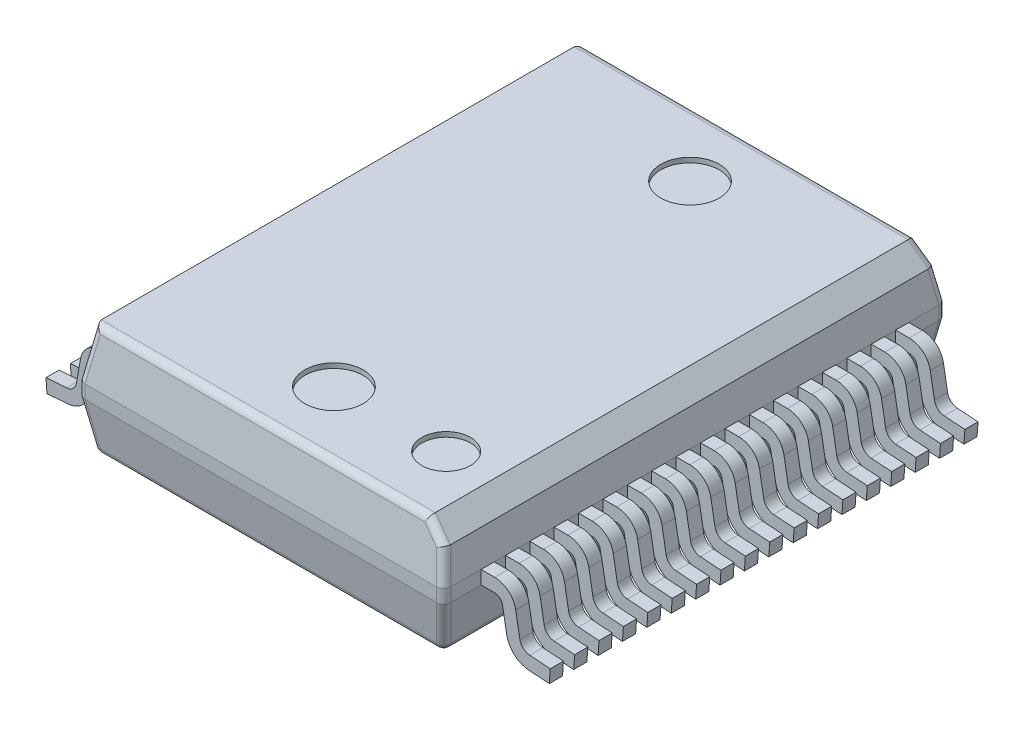
from build123d import *

# Parameters (mm, degrees)
SKETCH1_W               = 7.5
SKETCH1_H               = 10.3
BOSS_EXTRUDE1_DEPTH     = 2.28
CUT_EXTRUDE1_DEPTH      = 7.783354627
CUT_EXTRUDE1_DEPTH_BACK = 7.783354627
CUT_EXTRUDE2_DEPTH      = 7.783354627
CUT_EXTRUDE2_DEPTH_BACK = 7.783354627
SKETCH6_R               = 0.6
SKETCH6_R_2             = 0.5
CUT_EXTRUDE3_DEPTH      = 0.1
CHAMFER1_SIZE           = 0.3
CHAMFER1_SIZE2          = 0.369840916
SKETCH8_R               = 0.4
CUT_EXTRUDE4_DEPTH      = 0.1
FILLET1_R               = 0.15
BOSS_EXTRUDE2_DEPTH     = 0.05
BOSS_EXTRUDE2_2_DEPTH   = 0.05
BOSS_EXTRUDE2_3_DEPTH   = 0.05
SKETCH10_W              = 0.27
SKETCH10_H              = 0.275
LPATTERN1_COUNT         = 18
LPATTERN1_PITCH         = 0.5


with BuildPart() as part:
    # Sketch1 → Boss-Extrude1 (new body)
    with BuildSketch(Plane(origin=(0, 0.05, 0), x_dir=(-1, 0, 0), z_dir=(0, -1, 0))):
        Rectangle(SKETCH1_W, SKETCH1_H)
    extrude(amount=-BOSS_EXTRUDE1_DEPTH)

    # Sketch2 → Cut-Extrude1 (cut, two sides: drawn at the far end of the back side and taken through both)
    with BuildSketch(Plane(origin=(0, 0, 0), x_dir=(0, 0, -1), z_dir=(1, 0, 0)).offset(-CUT_EXTRUDE1_DEPTH_BACK)):
        Polygon((-5.15, 1.0525), (-4.973232202, 0.05), (-5.15, 0.05), align=None)
        Polygon((4.973232202, 0.05), (5.15, 0.05), (5.15, 1.0525), align=None)
        Polygon((-4.973232202, 2.33), (-5.15, 2.33), (-5.15, 1.3275), align=None)
        Polygon((4.973232202, 2.33), (5.15, 2.33), (5.15, 1.3275), align=None)
    extrude(amount=CUT_EXTRUDE1_DEPTH + CUT_EXTRUDE1_DEPTH_BACK, mode=Mode.SUBTRACT)

    # Sketch3 → Cut-Extrude2 (cut, two sides: drawn at the far end of the back side and taken through both)
    with BuildSketch(Plane.XY.offset(-CUT_EXTRUDE2_DEPTH_BACK)):
        Polygon((-3.75, 1.0525), (-3.573232202, 0.05), (-3.75, 0.05), align=None)
        Polygon((-3.573232202, 2.33), (-3.75, 2.33), (-3.75, 1.3275), align=None)
        Polygon((3.573232202, 0.05), (3.75, 0.05), (3.75, 1.0525), align=None)
        Polygon((3.573232202, 2.33), (3.75, 2.33), (3.75, 1.3275), align=None)
    extrude(amount=CUT_EXTRUDE2_DEPTH + CUT_EXTRUDE2_DEPTH_BACK, mode=Mode.SUBTRACT)

    # Sketch6 → Cut-Extrude3 (cut)
    with BuildSketch(Plane(origin=(0, 2.33, 0), x_dir=(1, 0, 0), z_dir=(0, 1, 0))):
        with Locations(Location((0, -3.65, 0), (0, 0, 270))):
            Circle(SKETCH6_R)
        with Locations(Location((2.3, -3.65, 0), (0, 0, 270))):
            Circle(SKETCH6_R_2)
        with Locations(Location((0, 3.65, 0), (0, 0, 90))):
            Circle(SKETCH6_R)
    extrude(amount=-CUT_EXTRUDE3_DEPTH, mode=Mode.SUBTRACT)

    # Chamfer1
    chamfer1_edges = [part.edges().sort_by_distance(p)[0] for p in [
        (3.573232202, 2.33, 0),
    ]]
    chamfer1_side = [part.faces().sort_by_distance(p)[0] for p in [
        (-0.026551385, 2.33, -0.042135894),
    ]]
    chamfer(chamfer1_edges, length=CHAMFER1_SIZE, length2=CHAMFER1_SIZE2, reference=chamfer1_side[0])

    # Sketch8 → Cut-Extrude4 (cut)
    with BuildSketch(Plane.XZ.offset(-0.05)):
        with Locations(Location((2.9, 4.3, 0), (0, 0, 270))):
            Circle(SKETCH8_R)
        with Locations(Location((0, 4.3, 0), (0, 0, 270))):
            Circle(SKETCH8_R)
        with Locations(Location((0, -4.3, 0), (0, 0, 90))):
            Circle(SKETCH8_R)
    extrude(amount=-CUT_EXTRUDE4_DEPTH, mode=Mode.SUBTRACT)

    # Fillet1
    # the kernel refuses this fillet: 0.15 mm, written as the material it takes off along each edge
    with BuildSketch(Plane(origin=(3.447367257, 0.2, -4.847367257), x_dir=(-0.112619742461807, -0.6386982979536941, 0.7611709911701118), z_dir=(0.5082206017326026, -0.6952867321825593, -0.5082206017326034))) as fillet1_piece_1_section:
        Polygon((-0.279329402, -0.279329402), (0.279329402, -0.279329402), (0.279329402, 0.279329402), (-0.279329402, 0.279329402), align=None)
    fillet1_piece_1 = extrude(amount=0.279329402, mode=Mode.PRIVATE)
    fillet1_piece_1 = split(fillet1_piece_1, bisect_by=Plane(origin=(3.447367257, 0.2, -4.847367257), z_dir=(0, 0, -1)), keep=Keep.TOP, mode=Mode.PRIVATE)
    fillet1_piece_1 = split(fillet1_piece_1, bisect_by=Plane(origin=(3.447367257, 0.2, -4.847367257), z_dir=(1, 0, 0)), keep=Keep.TOP, mode=Mode.PRIVATE)
    fillet1_piece_1 = split(fillet1_piece_1, bisect_by=Plane(origin=(3.447367257, 0.2, -4.847367257), z_dir=(-0.17108786974603082, -0.970287525247817, 0.17108786974602264)), keep=Keep.TOP, mode=Mode.PRIVATE)
    fillet1_piece_1 = split(fillet1_piece_1, bisect_by=Plane(origin=(3.59508842, 0.173952773, -4.847367257), z_dir=(-0.984807753012209, 0.1736481776669252, 0)), keep=Keep.TOP, mode=Mode.PRIVATE)
    fillet1_piece_1 = split(fillet1_piece_1, bisect_by=Plane(origin=(3.447367257, 0.05, -4.847367257), z_dir=(0, 1, 0)), keep=Keep.TOP, mode=Mode.PRIVATE)
    fillet1_piece_1 = split(fillet1_piece_1, bisect_by=Plane(origin=(3.447367257, 0.173952773, -4.99508842), z_dir=(0, 0.17364817766691715, 0.9848077530122105)), keep=Keep.TOP, mode=Mode.PRIVATE)
    fillet1_piece_1 = fillet1_piece_1 - Plane(origin=(3.447367257, 0.2, -4.847367257), x_dir=(-0.5082206017326026, 0.6952867321825593, 0.5082206017326034), z_dir=(-0.112619742461807, -0.6386982979536941, 0.7611709911701118)) * Sphere(FILLET1_R, mode=Mode.PRIVATE)
    add(fillet1_piece_1, mode=Mode.SUBTRACT)
    with BuildSketch(Plane(origin=(-3.447367257, 0.2, -4.847367257), x_dir=(-0.112619742461807, 0.6386982979536941, -0.7611709911701118), z_dir=(-0.5082206017326026, -0.6952867321825593, -0.5082206017326034))) as fillet1_piece_2_section:
        Polygon((-0.279329402, -0.279329402), (0.279329402, -0.279329402), (0.279329402, 0.279329402), (-0.279329402, 0.279329402), align=None)
    fillet1_piece_2 = extrude(amount=0.279329402, mode=Mode.PRIVATE)
    fillet1_piece_2 = split(fillet1_piece_2, bisect_by=Plane(origin=(-3.447367257, 0.2, -4.847367257), z_dir=(0, 0, -1)), keep=Keep.TOP, mode=Mode.PRIVATE)
    fillet1_piece_2 = split(fillet1_piece_2, bisect_by=Plane(origin=(-3.447367257, 0.2, -4.847367257), z_dir=(-1, 0, 0)), keep=Keep.TOP, mode=Mode.PRIVATE)
    fillet1_piece_2 = split(fillet1_piece_2, bisect_by=Plane(origin=(-3.447367257, 0.2, -4.847367257), z_dir=(0.17108786974603082, -0.970287525247817, 0.17108786974602264)), keep=Keep.TOP, mode=Mode.PRIVATE)
    fillet1_piece_2 = split(fillet1_piece_2, bisect_by=Plane(origin=(-3.59508842, 0.173952773, -4.847367257), z_dir=(0.984807753012209, 0.1736481776669252, 0)), keep=Keep.TOP, mode=Mode.PRIVATE)
    fillet1_piece_2 = split(fillet1_piece_2, bisect_by=Plane(origin=(-3.447367257, 0.05, -4.847367257), z_dir=(0, 1, 0)), keep=Keep.TOP, mode=Mode.PRIVATE)
    fillet1_piece_2 = split(fillet1_piece_2, bisect_by=Plane(origin=(-3.447367257, 0.173952773, -4.99508842), z_dir=(0, 0.17364817766691715, 0.9848077530122105)), keep=Keep.TOP, mode=Mode.PRIVATE)
    fillet1_piece_2 = fillet1_piece_2 - Plane(origin=(-3.447367257, 0.2, -4.847367257), x_dir=(0.5082206017326026, 0.6952867321825593, 0.5082206017326034), z_dir=(-0.112619742461807, 0.6386982979536941, -0.7611709911701118)) * Sphere(FILLET1_R, mode=Mode.PRIVATE)
    add(fillet1_piece_2, mode=Mode.SUBTRACT)
    with BuildSketch(Plane(origin=(3.447367257, 0.2, 4.847367257), x_dir=(0.11261974246180655, 0.6386982979536916, 0.7611709911701139), z_dir=(0.5082206017326015, -0.6952867321825612, 0.5082206017326016))) as fillet1_piece_3_section:
        Polygon((-0.279329402, -0.279329402), (0.279329402, -0.279329402), (0.279329402, 0.279329402), (-0.279329402, 0.279329402), align=None)
    fillet1_piece_3 = extrude(amount=0.279329402, mode=Mode.PRIVATE)
    fillet1_piece_3 = split(fillet1_piece_3, bisect_by=Plane(origin=(3.447367257, 0.2, 4.847367257), z_dir=(0, 0, 1)), keep=Keep.TOP, mode=Mode.PRIVATE)
    fillet1_piece_3 = split(fillet1_piece_3, bisect_by=Plane(origin=(3.447367257, 0.2, 4.847367257), z_dir=(1, 0, 0)), keep=Keep.TOP, mode=Mode.PRIVATE)
    fillet1_piece_3 = split(fillet1_piece_3, bisect_by=Plane(origin=(3.447367257, 0.2, 4.847367257), z_dir=(-0.1710878697460306, -0.9702875252478159, -0.1710878697460293)), keep=Keep.TOP, mode=Mode.PRIVATE)
    fillet1_piece_3 = split(fillet1_piece_3, bisect_by=Plane(origin=(3.59508842, 0.173952773, 4.847367257), z_dir=(-0.984807753012209, 0.1736481776669252, 0)), keep=Keep.TOP, mode=Mode.PRIVATE)
    fillet1_piece_3 = split(fillet1_piece_3, bisect_by=Plane(origin=(3.447367257, 0.05, 4.847367257), z_dir=(0, 1, 0)), keep=Keep.TOP, mode=Mode.PRIVATE)
    fillet1_piece_3 = split(fillet1_piece_3, bisect_by=Plane(origin=(3.447367257, 0.173952773, 4.99508842), z_dir=(0, 0.17364817766692392, -0.9848077530122092)), keep=Keep.TOP, mode=Mode.PRIVATE)
    fillet1_piece_3 = fillet1_piece_3 - Plane(origin=(3.447367257, 0.2, 4.847367257), x_dir=(-0.5082206017326015, 0.6952867321825612, -0.5082206017326016), z_dir=(0.11261974246180655, 0.6386982979536916, 0.7611709911701139)) * Sphere(FILLET1_R, mode=Mode.PRIVATE)
    add(fillet1_piece_3, mode=Mode.SUBTRACT)
    with BuildSketch(Plane(origin=(-3.447367257, 0.2, 4.847367257), x_dir=(0.11261974246180655, -0.6386982979536916, -0.7611709911701139), z_dir=(-0.5082206017326015, -0.6952867321825612, 0.5082206017326016))) as fillet1_piece_4_section:
        Polygon((-0.279329402, -0.279329402), (0.279329402, -0.279329402), (0.279329402, 0.279329402), (-0.279329402, 0.279329402), align=None)
    fillet1_piece_4 = extrude(amount=0.279329402, mode=Mode.PRIVATE)
    fillet1_piece_4 = split(fillet1_piece_4, bisect_by=Plane(origin=(-3.447367257, 0.2, 4.847367257), z_dir=(0, 0, 1)), keep=Keep.TOP, mode=Mode.PRIVATE)
    fillet1_piece_4 = split(fillet1_piece_4, bisect_by=Plane(origin=(-3.447367257, 0.2, 4.847367257), z_dir=(-1, 0, 0)), keep=Keep.TOP, mode=Mode.PRIVATE)
    fillet1_piece_4 = split(fillet1_piece_4, bisect_by=Plane(origin=(-3.447367257, 0.2, 4.847367257), z_dir=(0.1710878697460306, -0.9702875252478159, -0.1710878697460293)), keep=Keep.TOP, mode=Mode.PRIVATE)
    fillet1_piece_4 = split(fillet1_piece_4, bisect_by=Plane(origin=(-3.59508842, 0.173952773, 4.847367257), z_dir=(0.984807753012209, 0.1736481776669252, 0)), keep=Keep.TOP, mode=Mode.PRIVATE)
    fillet1_piece_4 = split(fillet1_piece_4, bisect_by=Plane(origin=(-3.447367257, 0.05, 4.847367257), z_dir=(0, 1, 0)), keep=Keep.TOP, mode=Mode.PRIVATE)
    fillet1_piece_4 = split(fillet1_piece_4, bisect_by=Plane(origin=(-3.447367257, 0.173952773, 4.99508842), z_dir=(0, 0.17364817766692392, -0.9848077530122092)), keep=Keep.TOP, mode=Mode.PRIVATE)
    fillet1_piece_4 = fillet1_piece_4 - Plane(origin=(-3.447367257, 0.2, 4.847367257), x_dir=(0.5082206017326015, 0.6952867321825612, -0.5082206017326016), z_dir=(0.11261974246180655, -0.6386982979536916, -0.7611709911701139)) * Sphere(FILLET1_R, mode=Mode.PRIVATE)
    add(fillet1_piece_4, mode=Mode.SUBTRACT)
    with BuildSketch(Plane(origin=(3.575202743, 2.318824505, 4.975202743), x_dir=(-0.9852557743173928, -0.16848866057223563, 0.029709096802304085), z_dir=(0.17108786974603052, -0.9702875252478159, 0.17108786974602924)), Plane(origin=(3.575202743, 2.318824505, -4.975202743), x_dir=(0.029709096802310944, -0.16848866057223996, 0.985255774317392), z_dir=(0.1710878697460303, -0.9702875252478148, -0.17108786974603593))) as fillet1_piece_5:
        with BuildLine():
            CenterArc((FILLET1_R * 0.970287525248, FILLET1_R), FILLET1_R, 181.727941072, 88.272058928)
            Line((-FILLET1_R * 0.0292577488659, FILLET1_R * 0.969846310393), (0, 0))
            Line((0, 0), (FILLET1_R * 0.970287525248, 0))
        make_face()
    extrude(amount=2.113254647, mode=Mode.SUBTRACT)
    with BuildSketch(Plane(origin=(3.040653446, 2.562578755, 4.932222292), x_dir=(-0.7124982932086706, -0.691013840829705, 0.12184438418126095), z_dir=(0.7016738431598626, -0.701673843159865, 0.12372403020647921)), Plane(origin=(3.040653446, 2.562578755, -4.932222292), x_dir=(0.08748610075473416, -0.08748610075473416, 0.9923166653591308), z_dir=(0.701673843159862, -0.7016738431598647, -0.12372403020648412))) as fillet1_piece_6:
        with BuildLine():
            CenterArc((FILLET1_R * 0.883900719217, FILLET1_R), FILLET1_R, 187.05302213, 82.94697787)
            Line((-FILLET1_R * 0.108532228239, FILLET1_R * 0.877212196031), (0, 0))
            Line((0, 0), (FILLET1_R * 0.883900719217, 0))
        make_face()
    extrude(amount=1.182001752, mode=Mode.SUBTRACT)
    with BuildSketch(Plane(origin=(3.75, -0.0725, 5.15), x_dir=(-1, 0, 0), z_dir=(0, 1, 0)), Plane(origin=(3.75, -0.0725, -5.15), x_dir=(0, 0, 1), z_dir=(0, 1, 0))) as fillet1_piece_7:
        with BuildLine():
            CenterArc((FILLET1_R, -FILLET1_R), FILLET1_R, 90, 90)
            Line((0, -FILLET1_R), (0, 0))
            Line((0, 0), (FILLET1_R, 0))
        make_face()
    extrude(amount=2.525, mode=Mode.SUBTRACT)
    with BuildSketch(Plane(origin=(-3.75, -0.0725, 5.15), x_dir=(1, 0, 0), z_dir=(0, 1, 0)), Plane(origin=(-3.75, -0.0725, -5.15), x_dir=(0, 0, 1), z_dir=(0, 1, 0))) as fillet1_piece_8:
        with BuildLine():
            CenterArc((FILLET1_R, FILLET1_R), FILLET1_R, 180, 90)
            Line((0, FILLET1_R), (0, 0))
            Line((0, 0), (FILLET1_R, 0))
        make_face()
    extrude(amount=2.525, mode=Mode.SUBTRACT)
    with BuildSketch(Plane(origin=(3.447367257, 0.05, -4.973232202), x_dir=(0, 0, 1), z_dir=(-1, 0, 0)), Plane(origin=(3.447367257, 0.05, 4.973232202), x_dir=(0, 0.9848077530122092, 0.17364817766692334), z_dir=(-1, 0, 0))) as fillet1_piece_9:
        with BuildLine():
            CenterArc((FILLET1_R * 0.839099631177, FILLET1_R), FILLET1_R, 190, 80)
            Line((-FILLET1_R * 0.145708121835, FILLET1_R * 0.826351822333), (0, 0))
            Line((0, 0), (FILLET1_R * 0.839099631177, 0))
        make_face()
    extrude(amount=6.894734514, mode=Mode.SUBTRACT)
    with BuildSketch(Plane(origin=(-3.936754979, 2.111640117, -5.336754979), x_dir=(-0.029709096802307763, 0.16848866057222697, 0.9852557743173941), z_dir=(0.17108786974603082, -0.970287525247817, 0.17108786974602264)), Plane(origin=(-3.936754979, 2.111640117, 5.336754979), x_dir=(0.9852557743173928, 0.1684886605722345, 0.029709096802311062), z_dir=(0.1710878697460306, -0.9702875252478159, -0.1710878697460293))) as fillet1_piece_10:
        with BuildLine():
            CenterArc((FILLET1_R * 0.970287525248, -FILLET1_R), FILLET1_R, 90, 88.272058928)
            Line((-FILLET1_R * 0.0292577488659, -FILLET1_R * 0.969846310393), (0, 0))
            Line((0, 0), (FILLET1_R * 0.970287525248, 0))
        make_face()
    extrude(amount=2.022297164, mode=Mode.SUBTRACT)
    with BuildSketch(Plane(origin=(-3.573232202, 0.05, 4.847367257), x_dir=(-0.1736481776669266, 0.9848077530122088, 0), z_dir=(0, 0, -1))) as fillet1_piece_11:
        with BuildLine():
            CenterArc((FILLET1_R * 0.839099631177, FILLET1_R), FILLET1_R, 190, 80)
            Line((-FILLET1_R * 0.145708121835, FILLET1_R * 0.826351822333), (0, 0))
            Line((0, 0), (FILLET1_R * 0.839099631177, 0))
        make_face()
    extrude(amount=9.694734514, mode=Mode.SUBTRACT)
    with BuildSketch(Plane(origin=(-3.887894564, 2.33, -4.973232202), x_dir=(0, 0, 1), z_dir=(1, 0, 0))) as fillet1_piece_12:
        with BuildLine():
            CenterArc((FILLET1_R * 0.839099631177, FILLET1_R), FILLET1_R, 190, 80)
            Line((-FILLET1_R * 0.145708121835, FILLET1_R * 0.826351822333), (0, 0))
            Line((0, 0), (FILLET1_R * 0.839099631177, 0))
        make_face()
    extrude(amount=7.475789127, mode=Mode.SUBTRACT)
    with BuildSketch(Plane(origin=(-3.510980542, 2.683046706, -4.910980542), x_dir=(-0.02970909680231042, -0.16848866057224002, 0.985255774317392), z_dir=(-0.1710878697460303, -0.9702875252478148, -0.17108786974603593)), Plane(origin=(-3.510980542, 2.683046706, 4.910980542), x_dir=(0.9852557743173928, -0.16848866057223563, 0.029709096802304085), z_dir=(-0.17108786974603052, -0.9702875252478159, 0.17108786974602924))) as fillet1_piece_13:
        with BuildLine():
            CenterArc((FILLET1_R * 0.970287525248, -FILLET1_R), FILLET1_R, 90, 88.272058928)
            Line((-FILLET1_R * 0.0292577488659, -FILLET1_R * 0.969846310393), (0, 0))
            Line((0, 0), (FILLET1_R * 0.970287525248, 0))
        make_face()
    extrude(amount=2.488630184, mode=Mode.SUBTRACT)
    with BuildSketch(Plane(origin=(3.587894564, 2.33, 4.973232202), x_dir=(0, -0.9848077530122094, 0.17364817766692295), z_dir=(-1, 0, 0))) as fillet1_piece_14:
        with BuildLine():
            CenterArc((FILLET1_R * 0.839099631177, -FILLET1_R), FILLET1_R, 90, 80)
            Line((-FILLET1_R * 0.145708121835, -FILLET1_R * 0.826351822333), (0, 0))
            Line((0, 0), (FILLET1_R * 0.839099631177, 0))
        make_face()
    extrude(amount=7.475789127, mode=Mode.SUBTRACT)
    with BuildSketch(Plane(origin=(3.936754979, 2.111640117, -5.336754979), x_dir=(0.029709096802307763, 0.16848866057222697, 0.9852557743173941), z_dir=(-0.17108786974603082, -0.970287525247817, 0.17108786974602264)), Plane(origin=(3.936754979, 2.111640117, 5.336754979), x_dir=(-0.9852557743173928, 0.1684886605722345, 0.029709096802311062), z_dir=(-0.1710878697460306, -0.9702875252478159, -0.1710878697460293))) as fillet1_piece_15:
        with BuildLine():
            CenterArc((FILLET1_R * 0.970287525248, FILLET1_R), FILLET1_R, 181.727941072, 88.272058928)
            Line((-FILLET1_R * 0.0292577488659, FILLET1_R * 0.969846310393), (0, 0))
            Line((0, 0), (FILLET1_R * 0.970287525248, 0))
        make_face()
    extrude(amount=2.022297164, mode=Mode.SUBTRACT)
    with BuildSketch(Plane(origin=(3.573232202, 0.05, 4.847367257), x_dir=(0.1736481776669266, 0.9848077530122088, 0), z_dir=(0, 0, -1))) as fillet1_piece_16:
        with BuildLine():
            CenterArc((FILLET1_R * 0.839099631177, -FILLET1_R), FILLET1_R, 90, 80)
            Line((-FILLET1_R * 0.145708121835, -FILLET1_R * 0.826351822333), (0, 0))
            Line((0, 0), (FILLET1_R * 0.839099631177, 0))
        make_face()
    extrude(amount=9.694734514, mode=Mode.SUBTRACT)


with BuildPart() as body_2:
    # Sketch14 → Boss-Extrude2 (new body)
    with BuildSketch(Plane.XZ.offset(-0.05)):
        with BuildLine():
            Line((2.35, 3.65), (0.55, 3.65))
            ThreePointArc((0.55, 3.65), (0.443933983, 3.606066017), (0.4, 3.5))
            Line((0.4, 3.5), (0.4, 0.55))
            ThreePointArc((0.4, 0.55), (0.443933983, 0.443933983), (0.55, 0.4))
            Line((0.55, 0.4), (2.35, 0.4))
            ThreePointArc((2.35, 0.4), (2.456066017, 0.443933983), (2.5, 0.55))
            Line((2.5, 0.55), (2.5, 3.5))
            ThreePointArc((2.5, 3.5), (2.456066017, 3.606066017), (2.35, 3.65))
        make_face()
    extrude(amount=BOSS_EXTRUDE2_DEPTH)


with BuildPart() as body_3:
    # Sketch14 → Boss-Extrude2 2 (new body)
    with BuildSketch(Plane.XZ.offset(-0.05)):
        with BuildLine():
            Line((-2.35, 3.65), (-0.55, 3.65))
            ThreePointArc((-0.55, 3.65), (-0.443933983, 3.606066017), (-0.4, 3.5))
            Line((-0.4, 3.5), (-0.4, 0.55))
            ThreePointArc((-0.4, 0.55), (-0.443933983, 0.443933983), (-0.55, 0.4))
            Line((-0.55, 0.4), (-2.35, 0.4))
            ThreePointArc((-2.35, 0.4), (-2.456066017, 0.443933983), (-2.5, 0.55))
            Line((-2.5, 0.55), (-2.5, 3.5))
            ThreePointArc((-2.5, 3.5), (-2.456066017, 3.606066017), (-2.35, 3.65))
        make_face()
    extrude(amount=BOSS_EXTRUDE2_2_DEPTH)


with BuildPart() as body_4:
    # Sketch14 → Boss-Extrude2 3 (new body)
    with BuildSketch(Plane.XZ.offset(-0.05)):
        with BuildLine():
            Line((2.325, -0.4), (-2.325, -0.4))
            ThreePointArc((-2.325, -0.4), (-2.431066017, -0.443933983), (-2.475, -0.55))
            Line((-2.475, -0.55), (-2.475, -3.5))
            ThreePointArc((-2.475, -3.5), (-2.431066017, -3.606066017), (-2.325, -3.65))
            Line((-2.325, -3.65), (2.325, -3.65))
            ThreePointArc((2.325, -3.65), (2.431066017, -3.606066017), (2.475, -3.5))
            Line((2.475, -3.5), (2.475, -0.55))
            ThreePointArc((2.475, -0.55), (2.431066017, -0.443933983), (2.325, -0.4))
        make_face()
    extrude(amount=BOSS_EXTRUDE2_3_DEPTH)


with BuildPart() as body_5:
    # Sweep1: sweep along a path in Sketch11
    with BuildLine(Plane.XY.offset(4.25)) as sweep1_path:
        Line((5.159591515, 0.137165057), (4.73850013, 0.166610635))
        ThreePointArc((4.73850013, 0.166610635), (4.523347637, 0.25793745), (4.410031561, 0.462365063))
        Line((4.410031561, 0.462365063), (4.325442326, 0.942094453))
        ThreePointArc((4.325442326, 0.942094453), (4.222836283, 1.119813333), (4.03, 1.19))
        Line((4.03, 1.19), (3.75, 1.19))
    # Sketch10 → Sweep1 (sweep)
    with BuildSketch(Plane(origin=(3.75, 0, 0), x_dir=(0, 0, -1), z_dir=(1, 0, 0))):
        with Locations((-4.25, 1.19)):
            Rectangle(SKETCH10_W, SKETCH10_H)
    sweep(path=sweep1_path.line)


with BuildPart() as lpattern1_1:
    # LPattern1: pattern copy
    add(body_5.part.moved(Location(Vector(0, 0, -1) * (1 * LPATTERN1_PITCH))))


with BuildPart() as lpattern1_2:
    # LPattern1: pattern copy
    add(body_5.part.moved(Location(Vector(0, 0, -1) * (2 * LPATTERN1_PITCH))))


with BuildPart() as lpattern1_3:
    # LPattern1: pattern copy
    add(body_5.part.moved(Location(Vector(0, 0, -1) * (3 * LPATTERN1_PITCH))))


with BuildPart() as lpattern1_4:
    # LPattern1: pattern copy
    add(body_5.part.moved(Location(Vector(0, 0, -1) * (4 * LPATTERN1_PITCH))))


with BuildPart() as lpattern1_5:
    # LPattern1: pattern copy
    add(body_5.part.moved(Location(Vector(0, 0, -1) * (5 * LPATTERN1_PITCH))))


with BuildPart() as lpattern1_6:
    # LPattern1: pattern copy
    add(body_5.part.moved(Location(Vector(0, 0, -1) * (6 * LPATTERN1_PITCH))))


with BuildPart() as lpattern1_7:
    # LPattern1: pattern copy
    add(body_5.part.moved(Location(Vector(0, 0, -1) * (7 * LPATTERN1_PITCH))))


with BuildPart() as lpattern1_8:
    # LPattern1: pattern copy
    add(body_5.part.moved(Location(Vector(0, 0, -1) * (8 * LPATTERN1_PITCH))))


with BuildPart() as lpattern1_9:
    # LPattern1: pattern copy
    add(body_5.part.moved(Location(Vector(0, 0, -1) * (9 * LPATTERN1_PITCH))))


with BuildPart() as lpattern1_10:
    # LPattern1: pattern copy
    add(body_5.part.moved(Location(Vector(0, 0, -1) * (10 * LPATTERN1_PITCH))))


with BuildPart() as lpattern1_11:
    # LPattern1: pattern copy
    add(body_5.part.moved(Location(Vector(0, 0, -1) * (11 * LPATTERN1_PITCH))))


with BuildPart() as lpattern1_12:
    # LPattern1: pattern copy
    add(body_5.part.moved(Location(Vector(0, 0, -1) * (12 * LPATTERN1_PITCH))))


with BuildPart() as lpattern1_13:
    # LPattern1: pattern copy
    add(body_5.part.moved(Location(Vector(0, 0, -1) * (13 * LPATTERN1_PITCH))))


with BuildPart() as lpattern1_14:
    # LPattern1: pattern copy
    add(body_5.part.moved(Location(Vector(0, 0, -1) * (14 * LPATTERN1_PITCH))))


with BuildPart() as lpattern1_15:
    # LPattern1: pattern copy
    add(body_5.part.moved(Location(Vector(0, 0, -1) * (15 * LPATTERN1_PITCH))))


with BuildPart() as lpattern1_16:
    # LPattern1: pattern copy
    add(body_5.part.moved(Location(Vector(0, 0, -1) * (16 * LPATTERN1_PITCH))))


with BuildPart() as lpattern1_17:
    # LPattern1: pattern copy
    add(body_5.part.moved(Location(Vector(0, 0, -1) * (17 * LPATTERN1_PITCH))))


with BuildPart() as body_23:
    # Mirror1: mirrored copy
    add(body_5.part.mirror(Plane(origin=(0, 0, 0), x_dir=(0, 0, 1), z_dir=(1, 0, 0))))


with BuildPart() as body_24:
    # Mirror1 2: mirrored copy
    add(lpattern1_1.part.mirror(Plane(origin=(0, 0, 0), x_dir=(0, 0, 1), z_dir=(1, 0, 0))))


with BuildPart() as body_25:
    # Mirror1 3: mirrored copy
    add(lpattern1_2.part.mirror(Plane(origin=(0, 0, 0), x_dir=(0, 0, 1), z_dir=(1, 0, 0))))


with BuildPart() as body_26:
    # Mirror1 4: mirrored copy
    add(lpattern1_3.part.mirror(Plane(origin=(0, 0, 0), x_dir=(0, 0, 1), z_dir=(1, 0, 0))))


with BuildPart() as body_27:
    # Mirror1 5: mirrored copy
    add(lpattern1_4.part.mirror(Plane(origin=(0, 0, 0), x_dir=(0, 0, 1), z_dir=(1, 0, 0))))


with BuildPart() as body_28:
    # Mirror1 6: mirrored copy
    add(lpattern1_5.part.mirror(Plane(origin=(0, 0, 0), x_dir=(0, 0, 1), z_dir=(1, 0, 0))))


with BuildPart() as body_29:
    # Mirror1 7: mirrored copy
    add(lpattern1_6.part.mirror(Plane(origin=(0, 0, 0), x_dir=(0, 0, 1), z_dir=(1, 0, 0))))


with BuildPart() as body_30:
    # Mirror1 8: mirrored copy
    add(lpattern1_7.part.mirror(Plane(origin=(0, 0, 0), x_dir=(0, 0, 1), z_dir=(1, 0, 0))))


with BuildPart() as body_31:
    # Mirror1 9: mirrored copy
    add(lpattern1_8.part.mirror(Plane(origin=(0, 0, 0), x_dir=(0, 0, 1), z_dir=(1, 0, 0))))


with BuildPart() as body_32:
    # Mirror1 10: mirrored copy
    add(lpattern1_9.part.mirror(Plane(origin=(0, 0, 0), x_dir=(0, 0, 1), z_dir=(1, 0, 0))))


with BuildPart() as body_33:
    # Mirror1 11: mirrored copy
    add(lpattern1_10.part.mirror(Plane(origin=(0, 0, 0), x_dir=(0, 0, 1), z_dir=(1, 0, 0))))


with BuildPart() as body_34:
    # Mirror1 12: mirrored copy
    add(lpattern1_11.part.mirror(Plane(origin=(0, 0, 0), x_dir=(0, 0, 1), z_dir=(1, 0, 0))))


with BuildPart() as body_35:
    # Mirror1 13: mirrored copy
    add(lpattern1_12.part.mirror(Plane(origin=(0, 0, 0), x_dir=(0, 0, 1), z_dir=(1, 0, 0))))


with BuildPart() as body_36:
    # Mirror1 14: mirrored copy
    add(lpattern1_13.part.mirror(Plane(origin=(0, 0, 0), x_dir=(0, 0, 1), z_dir=(1, 0, 0))))


with BuildPart() as body_37:
    # Mirror1 15: mirrored copy
    add(lpattern1_14.part.mirror(Plane(origin=(0, 0, 0), x_dir=(0, 0, 1), z_dir=(1, 0, 0))))


with BuildPart() as body_38:
    # Mirror1 16: mirrored copy
    add(lpattern1_15.part.mirror(Plane(origin=(0, 0, 0), x_dir=(0, 0, 1), z_dir=(1, 0, 0))))


with BuildPart() as body_39:
    # Mirror1 17: mirrored copy
    add(lpattern1_16.part.mirror(Plane(origin=(0, 0, 0), x_dir=(0, 0, 1), z_dir=(1, 0, 0))))


with BuildPart() as body_40:
    # Mirror1 18: mirrored copy
    add(lpattern1_17.part.mirror(Plane(origin=(0, 0, 0), x_dir=(0, 0, 1), z_dir=(1, 0, 0))))


solid = Compound([part.part, body_2.part, body_3.part, body_4.part, body_5.part, lpattern1_1.part, lpattern1_2.part, lpattern1_3.part, lpattern1_4.part, lpattern1_5.part, lpattern1_6.part, lpattern1_7.part, lpattern1_8.part, lpattern1_9.part, lpattern1_10.part, lpattern1_11.part, lpattern1_12.part, lpattern1_13.part, lpattern1_14.part, lpattern1_15.part, lpattern1_16.part, lpattern1_17.part, body_23.part, body_24.part, body_25.part, body_26.part, body_27.part, body_28.part, body_29.part, body_30.part, body_31.part, body_32.part, body_33.part, body_34.part, body_35.part, body_36.part, body_37.part, body_38.part, body_39.part, body_40.part])
